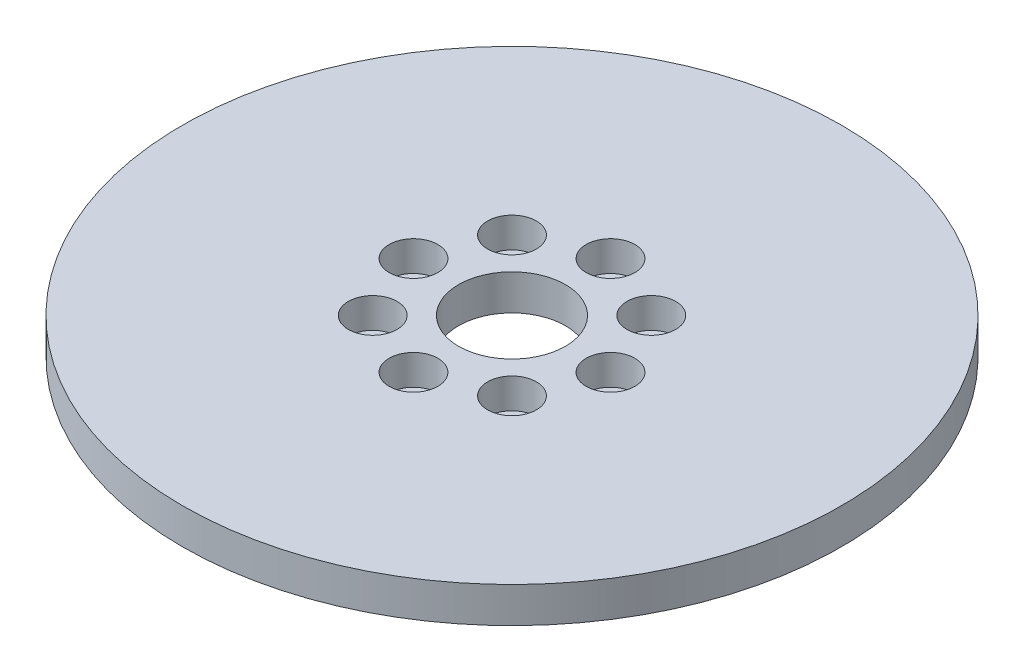
from build123d import *

# Parameters (mm, degrees)
SKETCH1_R           = 92.5
BOSS_EXTRUDE1_DEPTH = 10
SKETCH2_R           = 15
CUT_EXTRUDE1_DEPTH  = 132.196417634
SKETCH3_R           = 6.837022299
CUT_EXTRUDE2_DEPTH  = 8.46696136
CIRPATTERN1_COUNT   = 8


with BuildPart() as part:
    # Sketch1 → Boss-Extrude1 (new body)
    with BuildSketch(Plane(origin=(0, 0, 0), x_dir=(1, 0, 0), z_dir=(0, 1, 0))):
        Circle(SKETCH1_R)
    extrude(amount=BOSS_EXTRUDE1_DEPTH)

    # Sketch2 → Cut-Extrude1 (cut, through all)
    with BuildSketch(Plane(origin=(0, 0, 0), x_dir=(1, 0, 0), z_dir=(0, 1, 0))):
        Circle(SKETCH2_R)
    extrude(amount=CUT_EXTRUDE1_DEPTH, mode=Mode.SUBTRACT)

    # Sketch3 → Cut-Extrude2 (cut)
    with BuildSketch(Plane(origin=(0, 10, 0), x_dir=(1, 0, 0), z_dir=(0, 1, 0))):
        with Locations((-27.649021732, 0)):
            Circle(SKETCH3_R)
    cut_extrude2 = extrude(amount=-CUT_EXTRUDE2_DEPTH, mode=Mode.SUBTRACT)

    # CirPattern1: Cut-Extrude2 ×8 about axis
    cirpattern1_axis = Axis((0, 0, 0), (0, 1, 0))
    for i in range(1, CIRPATTERN1_COUNT):
        add(cut_extrude2.rotate(cirpattern1_axis, i * 360 / CIRPATTERN1_COUNT), mode=Mode.SUBTRACT)


solid = part.part
